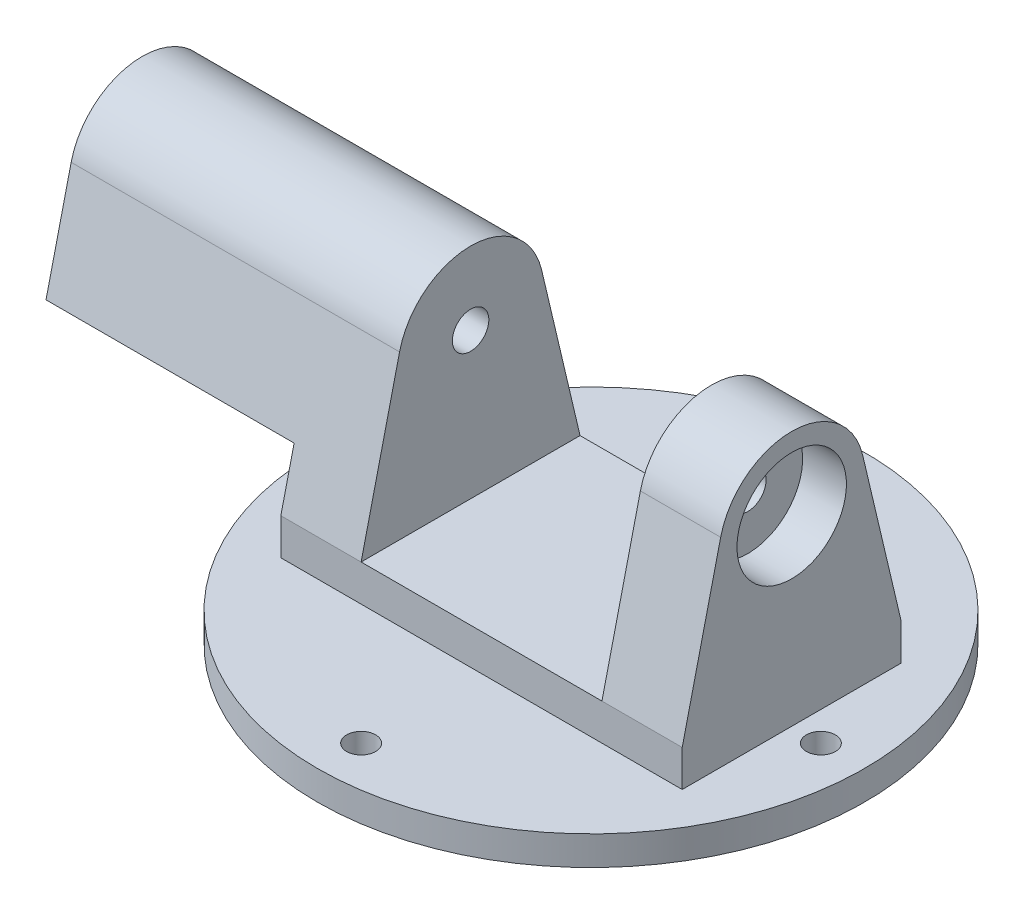
from build123d import *

# Parameters (mm, degrees)
CROQUIS1_R              = 75
SALIENTE_EXTRUIR1_DEPTH = 8
CROQUIS2_R              = 3.97
CORTAR_EXTRUIR1_DEPTH   = 20
SALIENTE_EXTRUIR2_DEPTH = 10
SALIENTE_EXTRUIR3_DEPTH = 22
CROQUIS5_R              = 15
CORTAR_EXTRUIR2_DEPTH   = 12
CROQUIS6_R              = 5
CORTAR_EXTRUIR3_DEPTH   = 126
CROQUIS7_R              = 15
SALIENTE_EXTRUIR4_DEPTH = 68


with BuildPart() as part:
    # Croquis1 → Saliente-Extruir1 (new body)
    with BuildSketch(Plane(origin=(0, 0, 0), x_dir=(1, 0, 0), z_dir=(0, 1, 0))):
        Circle(CROQUIS1_R)
    extrude(amount=SALIENTE_EXTRUIR1_DEPTH)

    # Croquis2 → Cortar-Extruir1 (cut)
    with BuildSketch(Plane(origin=(0, 8, 0), x_dir=(1, 0, 0), z_dir=(0, 1, 0))):
        with Locations((0, 63)):
            Circle(CROQUIS2_R)
        with Locations((63, 0)):
            Circle(CROQUIS2_R)
        with Locations((0, -63)):
            Circle(CROQUIS2_R)
        with Locations((-63, 0)):
            Circle(CROQUIS2_R)
    extrude(amount=-CORTAR_EXTRUIR1_DEPTH, mode=Mode.SUBTRACT)

    # Croquis3 → Saliente-Extruir2 (add)
    with BuildSketch(Plane(origin=(0, 8, 0), x_dir=(1, 0, 0), z_dir=(0, 1, 0))):
        Polygon((-55, 0), (-55, 30), (55, 30), (55, 0), (55, -30), (-55, -30), align=None)
    extrude(amount=SALIENTE_EXTRUIR2_DEPTH)

    # Croquis4 → Saliente-Extruir3 (add)
    with BuildSketch(Plane(origin=(55, 0, 0), x_dir=(0, 0, -1), z_dir=(1, 0, 0))):
        with BuildLine():
            Line((-30, 18), (30, 18))
            Line((30, 18), (19.464281728, 62.598174498))
            ThreePointArc((19.464281728, 62.598174498), (0, 78.000036798), (-19.464281728, 62.598174498))
            Line((-19.464281728, 62.598174498), (-30, 18))
        make_face()
    saliente_extruir3 = extrude(amount=-SALIENTE_EXTRUIR3_DEPTH)

    # Simetría1: Saliente-Extruir3 across plane
    add(saliente_extruir3.mirror(Plane(origin=(0, 0, 0), x_dir=(0, 0, 1), z_dir=(1, 0, 0))))

    # Croquis5 → Cortar-Extruir2 (cut)
    with BuildSketch(Plane.ZY.offset(55)):
        with Locations((0, 58)):
            Circle(CROQUIS5_R)
    cortar_extruir2 = extrude(amount=-CORTAR_EXTRUIR2_DEPTH, mode=Mode.SUBTRACT)

    # Simetría2: Cortar-Extruir2 across plane
    add(cortar_extruir2.mirror(Plane(origin=(0, 0, 0), x_dir=(0, 0, 1), z_dir=(1, 0, 0))), mode=Mode.SUBTRACT)

    # Croquis6 → Cortar-Extruir3 (cut)
    with BuildSketch(Plane.ZY.offset(43)):
        with Locations((0, 58)):
            Circle(CROQUIS6_R)
    extrude(amount=-CORTAR_EXTRUIR3_DEPTH, mode=Mode.SUBTRACT)

    # Croquis7 → Saliente-Extruir4 (add)
    with BuildSketch(Plane.ZY.offset(55)):
        with BuildLine():
            Line((-19.464281728, 62.598174498), (-26.361530786, 33.401805624))
            Line((-26.361530786, 33.401805624), (26.361530786, 33.401805624))
            Line((26.361530786, 33.401805624), (19.464281728, 62.598174498))
            ThreePointArc((19.464281728, 62.598174498), (0, 78.000036798), (-19.464281728, 62.598174498))
        make_face()
        with Locations((0, 58)):
            Circle(CROQUIS7_R, mode=Mode.SUBTRACT)
    extrude(amount=SALIENTE_EXTRUIR4_DEPTH)


solid = part.part
